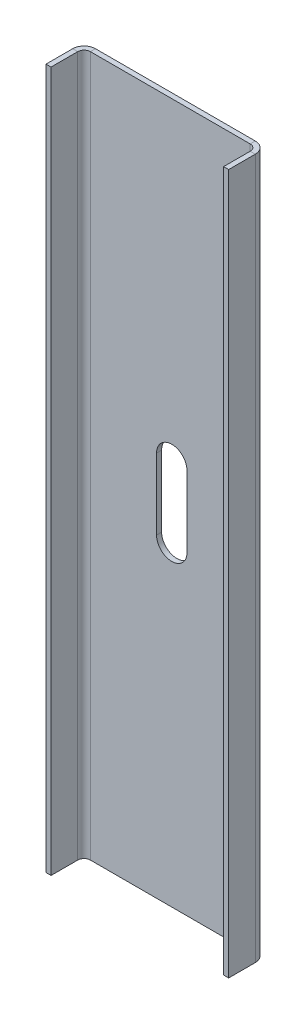
from build123d import *

# Parameters (mm, degrees)
SKETCH1_W                    = 72
SKETCH1_H                    = 276
BASE_FLANGE1_DEPTH           = 2
EDGE_FLANGE1_STRIP_W         = 13
EDGE_FLANGE1_STRIP_H         = 2
EDGE_FLANGE1_STRIP_CUT_DEPTH = 276
EDGE_FLANGE1_DEPTH           = 276
EDGE_FLANGE2_STRIP_W         = 13
EDGE_FLANGE2_STRIP_H         = 2
EDGE_FLANGE2_STRIP_CUT_DEPTH = 276
EDGE_FLANGE2_DEPTH           = 276
CUT_EXTRUDE1_DEPTH           = 183.834024801
CUT_EXTRUDE1_DEPTH_BACK      = 183.834024801


# Sheet-metal steps are written as plain solids
with BuildPart() as part:
    # Sketch1 → Base-Flange1 (new body)
    with BuildSketch(Plane.XY):
        with Locations((19.8, 35.625)):
            Rectangle(SKETCH1_W, SKETCH1_H)
    extrude(amount=-BASE_FLANGE1_DEPTH)

    # Edge-Flange1 strip (across the edge) → Edge-Flange1 strip cut (cut)
    with BuildSketch(Plane(origin=(55.8, -102.375, 0), x_dir=(-1, 0, 0), z_dir=(0, 1, 0))):
        with Locations((-2, -1)):
            Rectangle(EDGE_FLANGE1_STRIP_W, EDGE_FLANGE1_STRIP_H)
    extrude(amount=EDGE_FLANGE1_STRIP_CUT_DEPTH, mode=Mode.SUBTRACT)

    # Edge-Flange1 section (across the edge) → Edge-Flange1 (add)
    with BuildSketch(Plane(origin=(55.8, -102.375, 0), x_dir=(-1, 0, 0), z_dir=(0, 1, 0))):
        with BuildLine():
            Line((0, 2.5), (0, 13))
            Line((0, 13), (2, 13))
            Line((2, 13), (2, 2.5))
            ThreePointArc((2, 2.5), (2.732233047, 0.732233047), (4.5, 0))
            Line((4.5, 0), (4.5, -2))
            ThreePointArc((4.5, -2), (1.318019485, -0.681980515), (0, 2.5))
        make_face()
    extrude(amount=EDGE_FLANGE1_DEPTH)

    # Edge-Flange2 strip (across the edge) → Edge-Flange2 strip cut (cut)
    with BuildSketch(Plane(origin=(-16.2, 173.625, 0), x_dir=(1, 0, 0), z_dir=(0, -1, 0))):
        with Locations((-2, -1)):
            Rectangle(EDGE_FLANGE2_STRIP_W, EDGE_FLANGE2_STRIP_H)
    extrude(amount=EDGE_FLANGE2_STRIP_CUT_DEPTH, mode=Mode.SUBTRACT)

    # Edge-Flange2 section (across the edge) → Edge-Flange2 (add)
    with BuildSketch(Plane(origin=(-16.2, 173.625, 0), x_dir=(1, 0, 0), z_dir=(0, -1, 0))):
        with BuildLine():
            Line((0, 2.5), (0, 13))
            Line((0, 13), (2, 13))
            Line((2, 13), (2, 2.5))
            ThreePointArc((2, 2.5), (2.732233047, 0.732233047), (4.5, 0))
            Line((4.5, 0), (4.5, -2))
            ThreePointArc((4.5, -2), (1.318019485, -0.681980515), (0, 2.5))
        make_face()
    extrude(amount=EDGE_FLANGE2_DEPTH)

    # Sketch12 → Cut-Extrude1 (cut, two sides: drawn at the far end of the back side and taken through both)
    with BuildSketch(Plane.XY.offset(-CUT_EXTRUDE1_DEPTH_BACK)):
        with BuildLine():
            Line((26.38258059, 49.625), (26.38258059, 21.625))
            ThreePointArc((26.38258059, 21.625), (20.38258059, 15.625), (14.38258059, 21.625))
            Line((14.38258059, 21.625), (14.38258059, 49.625))
            ThreePointArc((14.38258059, 49.625), (20.38258059, 55.625), (26.38258059, 49.625))
        make_face()
    extrude(amount=CUT_EXTRUDE1_DEPTH + CUT_EXTRUDE1_DEPTH_BACK, mode=Mode.SUBTRACT)


solid = part.part
